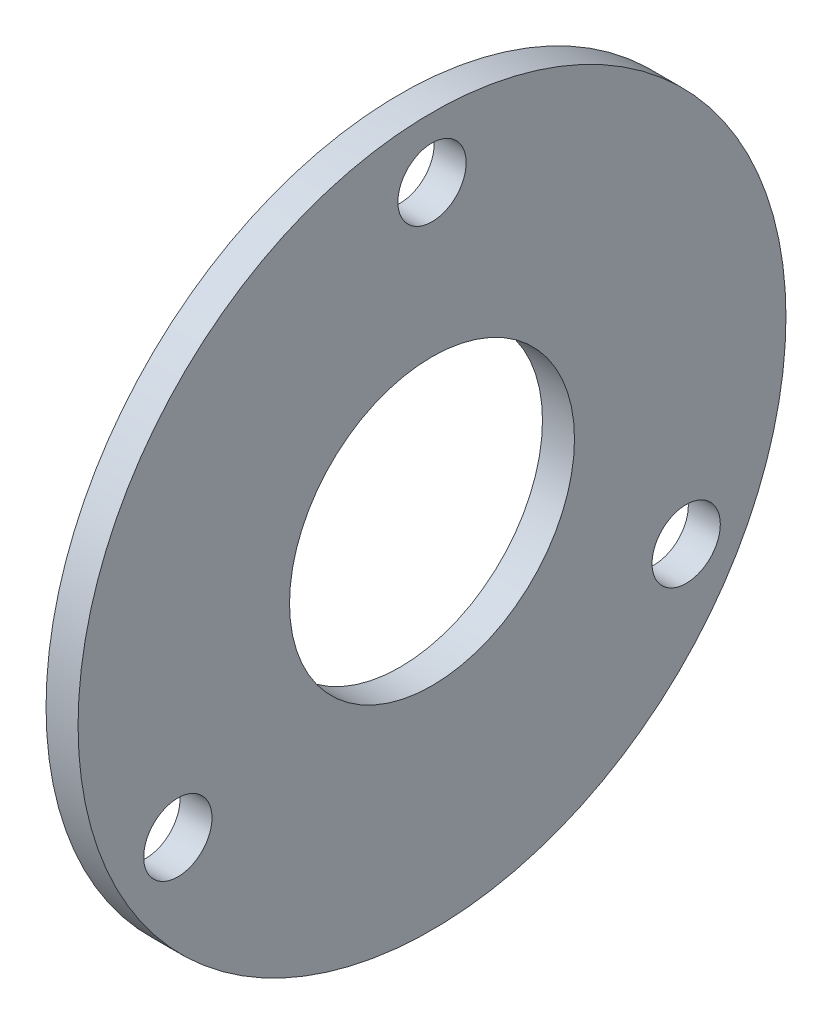
from build123d import *

# Parameters (mm, degrees)
SZKIC1_W                   = 3
SZKIC1_H                   = 19.815
SZKIC2_R                   = 3.2
WYTNIJ_WYCI_GNI_CIE1_DEPTH = 47.999650126


with BuildPart() as part:
    # Szkic1 → Obrót2 (revolve)
    with BuildSketch(Plane.XY):
        with Locations((-30.002520162, 23.2585)):
            Rectangle(SZKIC1_W, SZKIC1_H)
    revolve(axis=Axis((0, 0, 0), (-1, 0, 0)))

    # Szkic2 → Wytnij-wyciągnięcie1 (cut, through all)
    with BuildSketch(Plane(origin=(-28.502520162, 0, 0), x_dir=(0, 0, -1), z_dir=(1, 0, 0))):
        with Locations((0, 27.5)):
            Circle(SZKIC2_R)
        with Locations((23.815698604, -13.75)):
            Circle(SZKIC2_R)
        with Locations((-23.815698604, -13.75)):
            Circle(SZKIC2_R)
    extrude(amount=-WYTNIJ_WYCI_GNI_CIE1_DEPTH, mode=Mode.SUBTRACT)


solid = part.part
